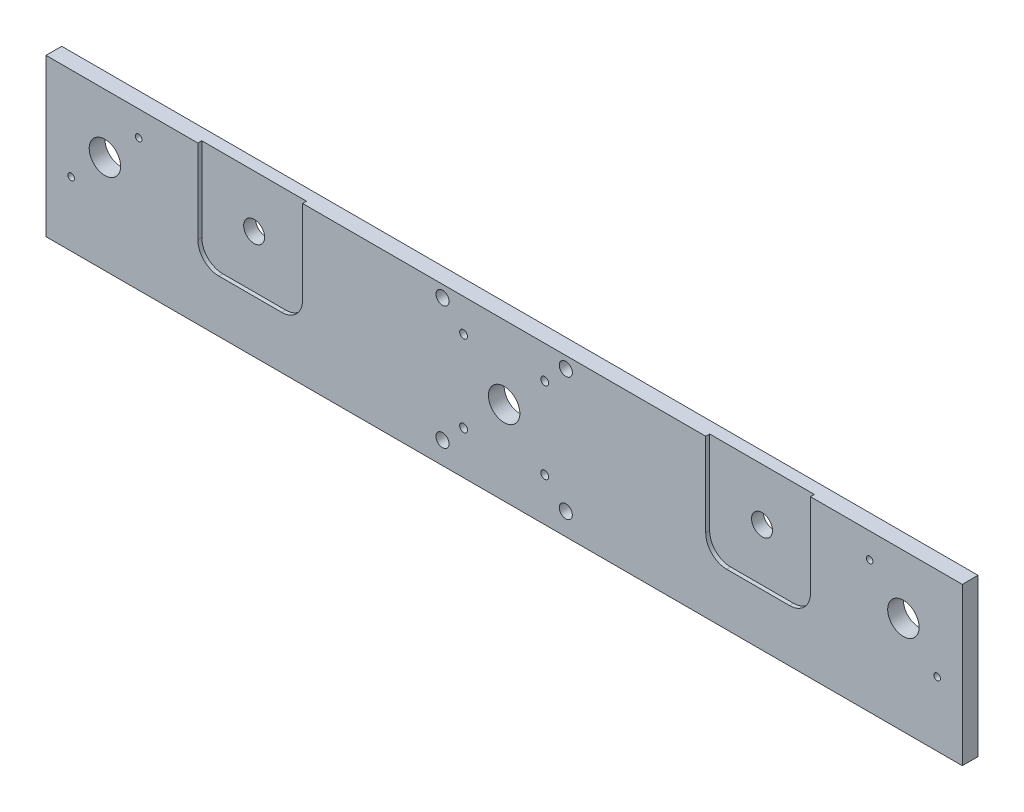
from build123d import *

# Parameters (mm, degrees)
CROQUIS1_W              = 350
CROQUIS1_H              = 60
SALIENTE_EXTRUIR1_DEPTH = 6
CROQUIS2_R              = 6
CROQUIS2_R_2            = 1.25
CORTAR_EXTRUIR1_DEPTH   = 356.156303619
CROQUIS3_R              = 6
CROQUIS3_R_2            = 1.5
CROQUIS3_R_3            = 2.5
CORTAR_EXTRUIR2_DEPTH   = 356.156303619
CORTAR_EXTRUIR4_DEPTH   = 1.5
CROQUIS7_R              = 4
CORTAR_EXTRUIR5_DEPTH   = 356.13412959


with BuildPart() as part:
    # Croquis1 → Saliente-Extruir1 (new body)
    with BuildSketch(Plane.XY):
        with Locations((-175, -30)):
            Rectangle(CROQUIS1_W, CROQUIS1_H)
    extrude(amount=SALIENTE_EXTRUIR1_DEPTH)

    # Croquis2 → Cortar-Extruir1 (cut, through all)
    with BuildSketch(Plane.XY.offset(6)):
        with Locations((-327.5, -22.5)):
            Circle(CROQUIS2_R)
        with Locations((-22.5, -22.5)):
            Circle(CROQUIS2_R)
        with Locations((-314.595301243, -9.595301243)):
            Circle(CROQUIS2_R_2)
        with Locations((-340.404698757, -35.404698757)):
            Circle(CROQUIS2_R_2)
        with Locations((-35.404698757, -9.595301243)):
            Circle(CROQUIS2_R_2)
        with Locations((-9.595301243, -35.404698757)):
            Circle(CROQUIS2_R_2)
    extrude(amount=-CORTAR_EXTRUIR1_DEPTH, mode=Mode.SUBTRACT)

    # Croquis3 → Cortar-Extruir2 (cut, through all)
    with BuildSketch(Plane.XY.offset(6)):
        with Locations((-175, -28)):
            Circle(CROQUIS3_R)
        with Locations((-190.5, -12.5)):
            Circle(CROQUIS3_R_2)
        with Locations((-159.5, -12.5)):
            Circle(CROQUIS3_R_2)
        with Locations((-190.5, -43.5)):
            Circle(CROQUIS3_R_2)
        with Locations((-151.45, -51.55)):
            Circle(CROQUIS3_R_3)
        with Locations((-198.55, -51.55)):
            Circle(CROQUIS3_R_3)
        with Locations((-159.5, -43.5)):
            Circle(CROQUIS3_R_2)
        with Locations((-151.45, -4.45)):
            Circle(CROQUIS3_R_3)
        with Locations((-198.55, -4.45)):
            Circle(CROQUIS3_R_3)
    extrude(amount=-CORTAR_EXTRUIR2_DEPTH, mode=Mode.SUBTRACT)

    # Croquis5 → Cortar-Extruir4 (cut)
    with BuildSketch(Plane.XY.offset(6)):
        with BuildLine():
            Line((-292, 0), (-252, 0))
            Line((-252, 0), (-252, -32))
            ThreePointArc((-252, -32), (-254.343145751, -37.656854249), (-260, -40))
            Line((-260, -40), (-284, -40))
            ThreePointArc((-284, -40), (-289.656854249, -37.656854249), (-292, -32))
            Line((-292, -32), (-292, 0))
        make_face()
        with BuildLine():
            Line((-98, 0), (-58, 0))
            Line((-58, 0), (-58, -32))
            ThreePointArc((-58, -32), (-60.343145751, -37.656854249), (-66, -40))
            Line((-66, -40), (-90, -40))
            ThreePointArc((-90, -40), (-95.656854249, -37.656854249), (-98, -32))
            Line((-98, -32), (-98, 0))
        make_face()
    extrude(amount=-CORTAR_EXTRUIR4_DEPTH, mode=Mode.SUBTRACT)

    # Croquis7 → Cortar-Extruir5 (cut, through all)
    with BuildSketch(Plane.XY.offset(4.5)):
        with Locations((-272, -20)):
            Circle(CROQUIS7_R)
        with Locations((-78, -20)):
            Circle(CROQUIS7_R)
    extrude(amount=-CORTAR_EXTRUIR5_DEPTH, mode=Mode.SUBTRACT)


solid = part.part
